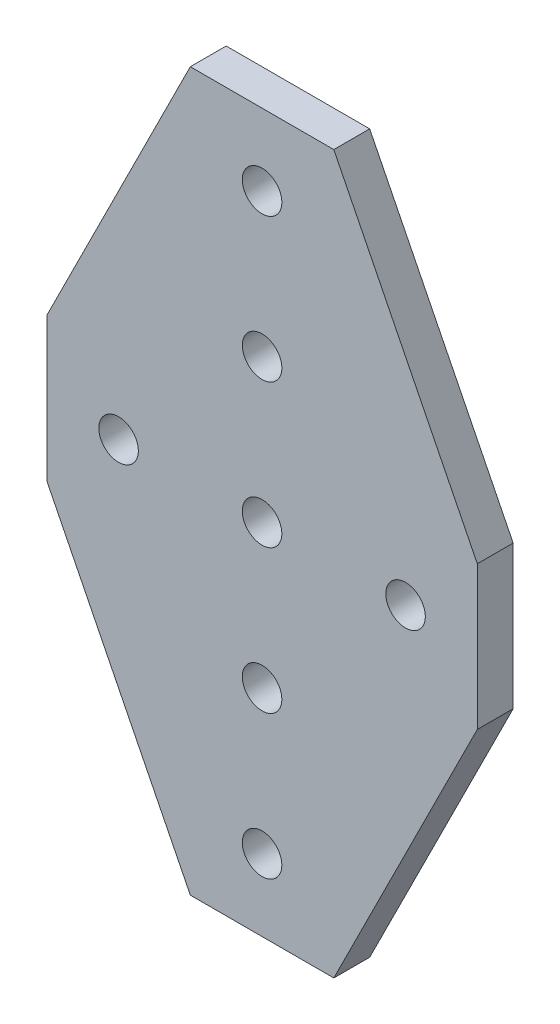
from build123d import *

# Parameters (mm, degrees)
BOSS_EXTRUDE1_DEPTH = 6.35
SKETCH2_R           = 3.5
CUT_EXTRUDE1_DEPTH  = 137.930502446


with BuildPart() as part:
    # Sketch1 → Boss-Extrude1 (new body)
    with BuildSketch(Plane.XY):
        Polygon((-25.4, 50.8), (-25.4, 76.2), (0, 127), (25.4, 127), (50.8, 76.2), (50.8, 50.8), (25.4, 0), (0, 0), align=None)
    extrude(amount=BOSS_EXTRUDE1_DEPTH)

    # Sketch2 → Cut-Extrude1 (cut, through all)
    with BuildSketch(Plane.XY.offset(6.35)):
        with Locations((12.7, 63.5)):
            Circle(SKETCH2_R)
        with Locations((38.1, 63.5)):
            Circle(SKETCH2_R)
        with Locations((-12.7, 63.5)):
            Circle(SKETCH2_R)
        with Locations((12.7, 38.1)):
            Circle(SKETCH2_R)
        with Locations((12.7, 12.7)):
            Circle(SKETCH2_R)
        with Locations((12.7, 114.3)):
            Circle(SKETCH2_R)
        with Locations((12.7, 88.9)):
            Circle(SKETCH2_R)
    extrude(amount=-CUT_EXTRUDE1_DEPTH, mode=Mode.SUBTRACT)


solid = part.part
